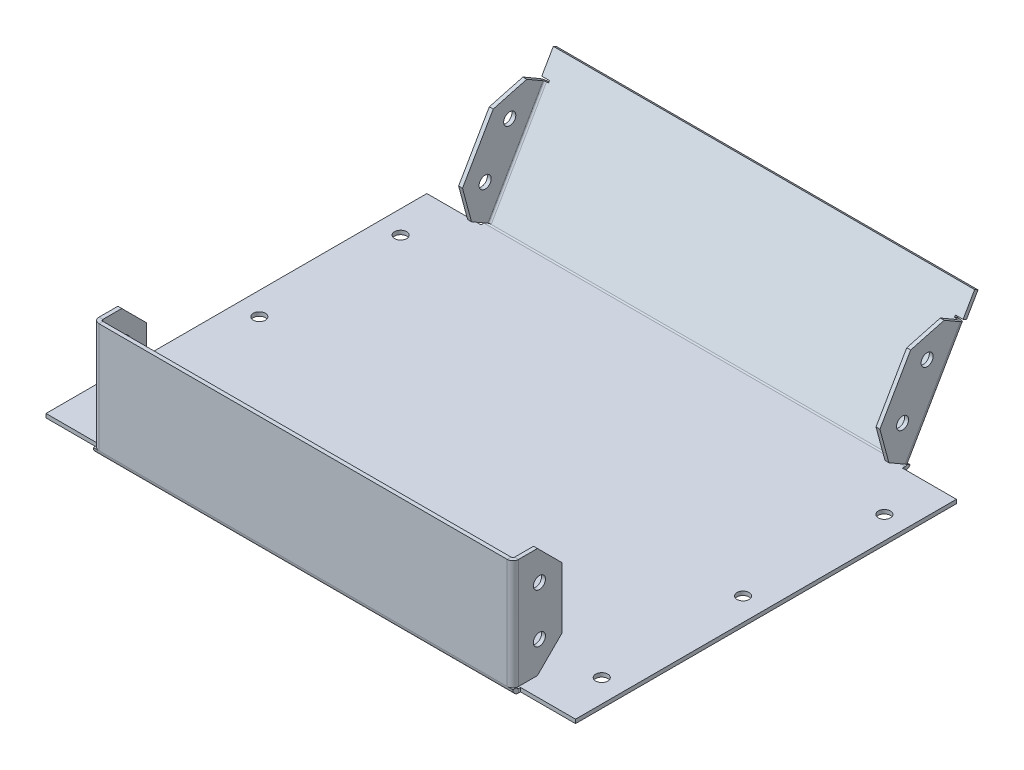
from build123d import *

# Parameters (mm, degrees)
BASE_FLANGE1_DEPTH             = 1.5875
SKETCHED_START                 = -86.375
SKETCHED_BEND1_DEPTH           = 170.75
SKETCHED_START_2               = -82.5
SKETCHED_BEND1_2_DEPTH         = 155
SKETCHED_BEND1_3_DEPTH         = 170.75
SKETCHED_START_3               = -160.625
SKETCHED_BEND1_4_OUTLINE_W     = 1.5875
SKETCHED_BEND1_4_OUTLINE_H     = 155
SKETCHED_BEND1_4_DEPTH         = 44.877834079
SKETCHED_START_4               = 113.747165921
SKETCHED_BEND1_5_OUTLINE_W     = 1.5875
SKETCHED_BEND1_5_OUTLINE_H     = 155
SKETCHED_BEND1_5_DEPTH         = 44.877834079
SKETCHED_BEND1_6_DEPTH         = 155
SKETCHED_START_5               = 75.622165921
SKETCHED_BEND1_7_OUTLINE_W     = 170.75
SKETCHED_BEND1_7_OUTLINE_H     = 1.5875
SKETCHED_BEND1_7_DEPTH         = 44.877834079
SKETCHED_START_6               = -86.725
SKETCHED_BEND2_DEPTH           = 171.45
SKETCHED_BEND2_2_DEPTH         = 171.45
EDGE_FLANGE1_STRIP_W           = 7.8232
EDGE_FLANGE1_STRIP_H           = 1.5875
EDGE_FLANGE1_STRIP_CUT_DEPTH   = 44.798065921
EDGE_FLANGE1_STRIP_2_W         = 7.8232
EDGE_FLANGE1_STRIP_2_H         = 1.5875
EDGE_FLANGE1_STRIP_CUT_2_DEPTH = 44.798065921
EDGE_FLANGE1_DEPTH             = 44.798065921
EDGE_FLANGE1_BEND_DEPTH        = 44.798065921
EDGE_FLANGE2_START             = 43.862084948
EDGE_FLANGE2_DEPTH             = 45.79375
EDGE_FLANGE2_START_2           = 88.862084948
EDGE_FLANGE2_2_DEPTH           = 0.79375
EDGE_FLANGE2_3_DEPTH           = 45
BREAK_CORNER1_START            = -86.725
BREAK_CORNER1_DEPTH            = 171.45
BOSS_EXTRUDE2_START            = -1.5875
BOSS_EXTRUDE2_DEPTH            = 1.5875
BOSS_EXTRUDE3_DEPTH            = 1.5875
CUT_EXTRUDE1_REACH             = 244.631
SKETCH24_R                     = 2.4638
CUT_EXTRUDE2_REACH             = 244.342
SKETCH26_R                     = 2.4638
SKETCH27_W                     = 214.486609943
SKETCH27_H                     = 74.493622792
CUT_EXTRUDE3_DEPTH             = 7
SKETCH28_W                     = 221.663194744
SKETCH28_H                     = 88.143732651
CUT_EXTRUDE4_DEPTH             = 7
SKETCH34_R                     = 2.4638
CUT_EXTRUDE6_DEPTH             = 165.746074293


# Read off the part's stored shape, not the designer's step: Sketched Bend1, Sketched Bend2, Edge-Flange2, Break-Corner1
# Sheet-metal steps are written as plain solids
with BuildPart() as part:
    # Sketch1 → Base-Flange1 (new body)
    with BuildSketch(Plane(origin=(0, 0, 0), x_dir=(1, 0, 0), z_dir=(0, 1, 0))):
        Polygon((-86.375, -72.5), (-86.375, -120.5), (84.375, -120.5), (84.375, -72.5), (110.625, -72.5), (158.625, -72.5), (158.625, 82.5), (110.625, 82.5), (84.725, 82.5), (84.725, 140.5), (-86.725, 140.5), (-86.725, 82.5), (-112.625, 82.5), (-160.625, 82.5), (-160.625, -72.5), (-112.625, -72.5), align=None)
    extrude(amount=BASE_FLANGE1_DEPTH)

    # Sketched Bend1 outline → Sketched Bend1 (add)
    with BuildSketch(Plane.YZ.offset(SKETCHED_START)):
        with BuildLine():
            Line((47.122165921, 74.034665921), (47.122165921, 75.622165921))
            Line((47.122165921, 75.622165921), (2.3241, 75.622165921))
            ThreePointArc((2.3241, 75.622165921), (1.950959343, 75.592015977), (1.5875, 75.5023484))
            Line((1.5875, 75.5023484), (1.5875, 73.298065921))
            ThreePointArc((1.5875, 73.298065921), (1.803245145, 73.818920776), (2.3241, 74.034665921))
            Line((2.3241, 74.034665921), (47.122165921, 74.034665921))
        make_face()
    extrude(amount=SKETCHED_BEND1_DEPTH)

    # Sketched Bend1 2 outline → Sketched Bend1 2 (add)
    with BuildSketch(Plane.XY.offset(SKETCHED_START_2)):
        with BuildLine():
            ThreePointArc((-113.423065921, 1.5875), (-113.943920776, 1.803245145), (-114.159665921, 2.3241))
            Line((-114.159665921, 2.3241), (-114.159665921, 47.122165921))
            Line((-114.159665921, 47.122165921), (-115.747165921, 47.122165921))
            Line((-115.747165921, 47.122165921), (-115.747165921, 2.3241))
            ThreePointArc((-115.747165921, 2.3241), (-115.717015977, 1.950959343), (-115.6273484, 1.5875))
            Line((-115.6273484, 1.5875), (-113.423065921, 1.5875))
        make_face()
        with BuildLine():
            ThreePointArc((112.159665921, 2.3241), (111.943920776, 1.803245145), (111.423065921, 1.5875))
            Line((111.423065921, 1.5875), (113.6273484, 1.5875))
            ThreePointArc((113.6273484, 1.5875), (113.717015977, 1.950959343), (113.747165921, 2.3241))
            Line((113.747165921, 2.3241), (113.747165921, 47.122165921))
            Line((113.747165921, 47.122165921), (112.159665921, 47.122165921))
            Line((112.159665921, 47.122165921), (112.159665921, 2.3241))
        make_face()
    extrude(amount=SKETCHED_BEND1_2_DEPTH)

    # Sketched Bend1 3 outline → Sketched Bend1 3 (cut)
    with BuildSketch(Plane.YZ.offset(SKETCHED_START)):
        with BuildLine():
            ThreePointArc((0, 73.298065921), (0.438182071, 74.656283273), (1.5875, 75.5023484))
            Line((1.5875, 75.5023484), (1.5875, 120.5))
            Line((1.5875, 120.5), (0, 120.5))
            Line((0, 120.5), (0, 73.298065921))
        make_face()
    extrude(amount=SKETCHED_BEND1_3_DEPTH, mode=Mode.SUBTRACT)

    # Sketched Bend1 4 outline → Sketched Bend1 4 (cut)
    with BuildSketch(Plane.YZ.offset(SKETCHED_START_3)):
        with Locations((0.79375, -5)):
            Rectangle(SKETCHED_BEND1_4_OUTLINE_W, SKETCHED_BEND1_4_OUTLINE_H)
    extrude(amount=SKETCHED_BEND1_4_DEPTH, mode=Mode.SUBTRACT)

    # Sketched Bend1 5 outline → Sketched Bend1 5 (cut)
    with BuildSketch(Plane.YZ.offset(SKETCHED_START_4)):
        with Locations((0.79375, -5)):
            Rectangle(SKETCHED_BEND1_5_OUTLINE_W, SKETCHED_BEND1_5_OUTLINE_H)
    extrude(amount=SKETCHED_BEND1_5_DEPTH, mode=Mode.SUBTRACT)

    # Sketched Bend1 6 outline → Sketched Bend1 6 (cut)
    with BuildSketch(Plane.XY.offset(SKETCHED_START_2)):
        with BuildLine():
            ThreePointArc((-113.423065921, 0), (-114.781283273, 0.438182071), (-115.6273484, 1.5875))
            Line((-115.6273484, 1.5875), (-160.625, 1.5875))
            Line((-160.625, 1.5875), (-160.625, 0))
            Line((-160.625, 0), (-113.423065921, 0))
        make_face()
        with BuildLine():
            Line((158.625, 1.5875), (113.6273484, 1.5875))
            ThreePointArc((113.6273484, 1.5875), (112.781283273, 0.438182071), (111.423065921, 0))
            Line((111.423065921, 0), (158.625, 0))
            Line((158.625, 0), (158.625, 1.5875))
        make_face()
    extrude(amount=SKETCHED_BEND1_6_DEPTH, mode=Mode.SUBTRACT)

    # Sketched Bend1 7 outline → Sketched Bend1 7 (cut)
    with BuildSketch(Plane.XY.offset(SKETCHED_START_5)):
        with Locations((-1, 0.79375)):
            Rectangle(SKETCHED_BEND1_7_OUTLINE_W, SKETCHED_BEND1_7_OUTLINE_H)
    extrude(amount=SKETCHED_BEND1_7_DEPTH, mode=Mode.SUBTRACT)

    # Sketched Bend2 outline → Sketched Bend2 (cut)
    with BuildSketch(Plane.YZ.offset(SKETCHED_START_6)):
        with BuildLine():
            Line((1.5875, -140.5), (1.5875, -85.957073927))
            Line((1.5875, -85.957073927), (1.16205, -85.711440255))
            ThreePointArc((1.16205, -85.711440255), (0.311370359, -84.860760614), (0, -83.698710614))
            Line((0, -83.698710614), (0, -140.5))
            Line((0, -140.5), (1.5875, -140.5))
        make_face()
    extrude(amount=SKETCHED_BEND2_DEPTH, mode=Mode.SUBTRACT)

    # Sketched Bend2 2 outline → Sketched Bend2 2 (add)
    with BuildSketch(Plane.YZ.offset(SKETCHED_START_6)):
        with BuildLine():
            Line((49.759285648, -111.935980233), (1.9558, -84.336624926))
            ThreePointArc((1.9558, -84.336624926), (1.686185688, -84.067010614), (1.5875, -83.698710614))
            Line((1.5875, -83.698710614), (1.5875, -85.957073927))
            Line((1.5875, -85.957073927), (48.965535648, -113.310795562))
            Line((48.965535648, -113.310795562), (49.759285648, -111.935980233))
        make_face()
    extrude(amount=SKETCHED_BEND2_2_DEPTH)

    # Edge-Flange1 strip (across the edge) → Edge-Flange1 strip cut (cut)
    with BuildSketch(Plane(origin=(84.375, 47.122165921, 74.034665921), x_dir=(-1, 0, 0), z_dir=(0, -1, 0))):
        with Locations((-1.5875, -0.79375)):
            Rectangle(EDGE_FLANGE1_STRIP_W, EDGE_FLANGE1_STRIP_H)
    extrude(amount=EDGE_FLANGE1_STRIP_CUT_DEPTH, mode=Mode.SUBTRACT)

    # Edge-Flange1 strip 2 (across the edge) → Edge-Flange1 strip cut 2 (cut)
    with BuildSketch(Plane(origin=(-86.375, 2.3241, 74.034665921), x_dir=(1, 0, 0), z_dir=(0, 1, 0))):
        with Locations((-1.5875, -0.79375)):
            Rectangle(EDGE_FLANGE1_STRIP_2_W, EDGE_FLANGE1_STRIP_2_H)
    extrude(amount=EDGE_FLANGE1_STRIP_CUT_2_DEPTH, mode=Mode.SUBTRACT)

    # Edge-Flange1 section (across the edge) → Edge-Flange1 (add)
    with BuildSketch(Plane(origin=(84.375, 47.122165921, 74.034665921), x_dir=(-1, 0, 0), z_dir=(0, -1, 0))):
        with BuildLine():
            Line((0, 0.7366), (0, 18.4125))
            Line((0, 18.4125), (1.5875, 18.4125))
            Line((1.5875, 18.4125), (1.5875, 0.7366))
            ThreePointArc((1.5875, 0.7366), (1.803245145, 0.215745145), (2.3241, 0))
            Line((2.3241, 0), (2.3241, -1.5875))
            ThreePointArc((2.3241, -1.5875), (0.68071313, -0.90678687), (0, 0.7366))
        make_face()
    extrude(amount=EDGE_FLANGE1_DEPTH)

    # Edge-Flange1 section 2 (across the edge) → Edge-Flange1 bend (add)
    with BuildSketch(Plane(origin=(-86.375, 2.3241, 74.034665921), x_dir=(1, 0, 0), z_dir=(0, 1, 0))):
        with BuildLine():
            Line((0, 0.7366), (0, 18.4125))
            Line((0, 18.4125), (1.5875, 18.4125))
            Line((1.5875, 18.4125), (1.5875, 0.7366))
            ThreePointArc((1.5875, 0.7366), (1.803245145, 0.215745145), (2.3241, 0))
            Line((2.3241, 0), (2.3241, -1.5875))
            ThreePointArc((2.3241, -1.5875), (0.68071313, -0.90678687), (0, 0.7366))
        make_face()
    extrude(amount=EDGE_FLANGE1_BEND_DEPTH)

    # Edge-Flange2 outline → Edge-Flange2 (cut)
    with BuildSketch(Plane(origin=(0, 0, 0), x_dir=(1, 0, 0), z_dir=(0, 0.8660254037844406, -0.4999999999999967)).offset(EDGE_FLANGE2_START)):
        with BuildLine():
            Line((-86.725, 72.059759656), (-86.605182479, 72.059759656))
            ThreePointArc((-86.605182479, 72.059759656), (-85.759117352, 73.209077585), (-84.4009, 73.647259656))
            Line((-84.4009, 73.647259656), (-86.725, 73.647259656))
            Line((-86.725, 73.647259656), (-86.725, 72.059759656))
        make_face()
        with BuildLine():
            Line((84.725, 73.647259656), (82.4009, 73.647259656))
            ThreePointArc((82.4009, 73.647259656), (83.759117352, 73.209077585), (84.605182479, 72.059759656))
            Line((84.605182479, 72.059759656), (84.725, 72.059759656))
            Line((84.725, 72.059759656), (84.725, 73.647259656))
        make_face()
    extrude(amount=EDGE_FLANGE2_DEPTH, mode=Mode.SUBTRACT)

    # Edge-Flange2 2 outline → Edge-Flange2 2 (cut)
    with BuildSketch(Plane(origin=(0, 0, 0), x_dir=(1, 0, 0), z_dir=(0, 0.8660254037844406, -0.4999999999999967)).offset(EDGE_FLANGE2_START_2)):
        with BuildLine():
            ThreePointArc((-84.4009, 73.647259656), (-85.759117352, 73.209077585), (-86.605182479, 72.059759656))
            Line((-86.605182479, 72.059759656), (-83.60715, 72.059759656))
            Line((-83.60715, 72.059759656), (-83.60715, 73.647259656))
            Line((-83.60715, 73.647259656), (-84.4009, 73.647259656))
        make_face()
        with BuildLine():
            Line((81.60715, 73.647259656), (81.60715, 72.059759656))
            Line((81.60715, 72.059759656), (84.605182479, 72.059759656))
            ThreePointArc((84.605182479, 72.059759656), (83.759117352, 73.209077585), (82.4009, 73.647259656))
            Line((82.4009, 73.647259656), (81.60715, 73.647259656))
        make_face()
    extrude(amount=EDGE_FLANGE2_2_DEPTH, mode=Mode.SUBTRACT)

    # Edge-Flange2 3 outline → Edge-Flange2 3 (add)
    with BuildSketch(Plane(origin=(0, 0, 0), x_dir=(1, 0, 0), z_dir=(0, 0.8660254037844406, -0.4999999999999967)).offset(EDGE_FLANGE2_START)):
        with BuildLine():
            Line((-86.725, 71.323159656), (-86.725, 53.647259656))
            Line((-86.725, 53.647259656), (-85.1375, 53.647259656))
            Line((-85.1375, 53.647259656), (-85.1375, 71.323159656))
            ThreePointArc((-85.1375, 71.323159656), (-84.921754855, 71.844014511), (-84.4009, 72.059759656))
            Line((-84.4009, 72.059759656), (-86.605182479, 72.059759656))
            ThreePointArc((-86.605182479, 72.059759656), (-86.694850056, 71.696300313), (-86.725, 71.323159656))
        make_face()
        with BuildLine():
            Line((84.605182479, 72.059759656), (82.4009, 72.059759656))
            ThreePointArc((82.4009, 72.059759656), (82.921754855, 71.844014511), (83.1375, 71.323159656))
            Line((83.1375, 71.323159656), (83.1375, 53.647259656))
            Line((83.1375, 53.647259656), (84.725, 53.647259656))
            Line((84.725, 53.647259656), (84.725, 71.323159656))
            ThreePointArc((84.725, 71.323159656), (84.694850056, 71.696300313), (84.605182479, 72.059759656))
        make_face()
    extrude(amount=EDGE_FLANGE2_3_DEPTH)

    # Break-Corner1 outline → Break-Corner1 (cut)
    with BuildSketch(Plane.YZ.offset(BREAK_CORNER1_START)):
        Polygon((50.13319317, -90.890932179), (41.472939132, -85.890932179), (45.13319317, -99.551186217), align=None)
        Polygon((6.16205, -77.051186217), (19.822304038, -73.390932179), (11.16205, -68.390932179), align=None)
        Polygon((47.122165921, 55.622165921), (47.122165921, 65.622165921), (37.122165921, 55.622165921), align=None)
        Polygon((2.3241, 55.622165921), (12.3241, 55.622165921), (2.3241, 65.622165921), align=None)
    extrude(amount=BREAK_CORNER1_DEPTH, mode=Mode.SUBTRACT)

    # Sketch21 → Boss-Extrude2 (add)
    with BuildSketch(Plane.ZY.offset(115.747165921).offset(BOSS_EXTRUDE2_START)):
        Polygon((-82.5, 2.3241), (-82.5, 47.122165921), (-127.298065921, 47.122165921), align=None)
    extrude(amount=BOSS_EXTRUDE2_DEPTH)

    # Sketch22 → Boss-Extrude3 (add)
    with BuildSketch(Plane(origin=(113.747165921, 0, 0), x_dir=(0, 0, -1), z_dir=(1, 0, 0))):
        Polygon((82.5, 2.3241), (82.5, 47.122165921), (127.298065921, 47.122165921), align=None)
    extrude(amount=-BOSS_EXTRUDE3_DEPTH)

    # Sketch24 → Cut-Extrude1 (cut, up to next)
    with BuildSketch(Plane.ZY.offset(86.725), mode=Mode.PRIVATE) as cut_extrude1_sk1:
        with Locations((-92.613778553, 34.704750623)):
            Circle(SKETCH24_R)
    cut_extrude1_tool1 = extrude(cut_extrude1_sk1.sketch, amount=-CUT_EXTRUDE1_REACH, mode=Mode.PRIVATE) & part.part
    # Sketch24 → Cut-Extrude1 (cut, up to next)
    with BuildSketch(Plane.ZY.offset(86.725), mode=Mode.PRIVATE) as cut_extrude1_sk2:
        with Locations(Location((-82.613778553, 17.384242547, 0), (0, 0, 180))):
            Circle(SKETCH24_R)
    cut_extrude1_tool2 = extrude(cut_extrude1_sk2.sketch, amount=-CUT_EXTRUDE1_REACH, mode=Mode.PRIVATE) & part.part
    cut_extrude1_1 = cut_extrude1_tool1.solids().sort_by_distance((-86.725, 34.704751, -92.613779))[0]
    add(cut_extrude1_1, mode=Mode.SUBTRACT)
    cut_extrude1_2 = cut_extrude1_tool2.solids().sort_by_distance((-86.725, 17.384243, -82.613779))[0]
    add(cut_extrude1_2, mode=Mode.SUBTRACT)
    cut_extrude1 = cut_extrude1_1 + cut_extrude1_2  # Cut-Extrude1 as one shape, for the pattern or mirror that repeats it

    # Sketch26 → Cut-Extrude2 (cut, up to next)
    with BuildSketch(Plane.ZY.offset(86.375), mode=Mode.PRIVATE) as cut_extrude2_sk1:
        with Locations((64.828415921, 34.72313296)):
            Circle(SKETCH26_R)
    cut_extrude2_tool1 = extrude(cut_extrude2_sk1.sketch, amount=-CUT_EXTRUDE2_REACH, mode=Mode.PRIVATE) & part.part
    # Sketch26 → Cut-Extrude2 (cut, up to next)
    with BuildSketch(Plane.ZY.offset(86.375), mode=Mode.PRIVATE) as cut_extrude2_sk2:
        with Locations(Location((64.828415921, 14.72313296, 0), (0, 0, 180))):
            Circle(SKETCH26_R)
    cut_extrude2_tool2 = extrude(cut_extrude2_sk2.sketch, amount=-CUT_EXTRUDE2_REACH, mode=Mode.PRIVATE) & part.part
    cut_extrude2_1 = cut_extrude2_tool1.solids().sort_by_distance((-86.375, 34.723133, 64.828416))[0]
    add(cut_extrude2_1, mode=Mode.SUBTRACT)
    cut_extrude2_2 = cut_extrude2_tool2.solids().sort_by_distance((-86.375, 14.723133, 64.828416))[0]
    add(cut_extrude2_2, mode=Mode.SUBTRACT)
    cut_extrude2 = cut_extrude2_1 + cut_extrude2_2  # Cut-Extrude2 as one shape, for the pattern or mirror that repeats it

    # Mirror1: Cut-Extrude1, Cut-Extrude2 mirrored; each copy of Cut-Extrude1, Cut-Extrude2 runs up to whatever stops it at its own place
    mirror1_before = part.part  # the part as the pattern finds it: every copy runs up to it
    mirror1_cut_extrude1_long1 = extrude(cut_extrude1_sk1.sketch, amount=-CUT_EXTRUDE1_REACH, mode=Mode.PRIVATE)
    mirror1_cut_extrude1_long2 = extrude(cut_extrude1_sk2.sketch, amount=-CUT_EXTRUDE1_REACH, mode=Mode.PRIVATE)
    mirror1_cut_extrude1_tool1_1 = mirror1_cut_extrude1_long1.mirror(Plane(origin=(0, 0, 0), x_dir=(0, 0, 1), z_dir=(1, 0, 0))) & mirror1_before
    add(mirror1_cut_extrude1_tool1_1.solids().sort_by_distance((86.725, 34.704751, -92.613779))[0], mode=Mode.SUBTRACT)
    mirror1_cut_extrude1_tool2_1 = mirror1_cut_extrude1_long2.mirror(Plane(origin=(0, 0, 0), x_dir=(0, 0, 1), z_dir=(1, 0, 0))) & mirror1_before
    add(mirror1_cut_extrude1_tool2_1.solids().sort_by_distance((86.725, 17.384243, -82.613779))[0], mode=Mode.SUBTRACT)
    mirror1_cut_extrude2_long1 = extrude(cut_extrude2_sk1.sketch, amount=-CUT_EXTRUDE2_REACH, mode=Mode.PRIVATE)
    mirror1_cut_extrude2_long2 = extrude(cut_extrude2_sk2.sketch, amount=-CUT_EXTRUDE2_REACH, mode=Mode.PRIVATE)
    mirror1_cut_extrude2_tool1_1 = mirror1_cut_extrude2_long1.mirror(Plane(origin=(0, 0, 0), x_dir=(0, 0, 1), z_dir=(1, 0, 0))) & mirror1_before
    add(mirror1_cut_extrude2_tool1_1.solids().sort_by_distance((86.375, 34.723133, 64.828416))[0], mode=Mode.SUBTRACT)
    mirror1_cut_extrude2_tool2_1 = mirror1_cut_extrude2_long2.mirror(Plane(origin=(0, 0, 0), x_dir=(0, 0, 1), z_dir=(1, 0, 0))) & mirror1_before
    add(mirror1_cut_extrude2_tool2_1.solids().sort_by_distance((86.375, 14.723133, 64.828416))[0], mode=Mode.SUBTRACT)

    # Sketch27 → Cut-Extrude3 (cut)
    with BuildSketch(Plane.ZY.offset(115.747165921)):
        with Locations((-25.482320462, 18.910964918)):
            Rectangle(SKETCH27_W, SKETCH27_H)
    extrude(amount=-CUT_EXTRUDE3_DEPTH, mode=Mode.SUBTRACT)

    # Sketch28 → Cut-Extrude4 (cut)
    with BuildSketch(Plane(origin=(113.747165921, 0, 0), x_dir=(0, 0, -1), z_dir=(1, 0, 0))):
        with Locations((27.271761176, 22.455760889)):
            Rectangle(SKETCH28_W, SKETCH28_H)
    extrude(amount=-CUT_EXTRUDE4_DEPTH, mode=Mode.SUBTRACT)

    # Sketch34 → Cut-Extrude6 (cut, through all)
    with BuildSketch(Plane(origin=(0, 0, 0), x_dir=(-1, 0, 0), z_dir=(0, -1, 0))):
        with Locations(Location((-97.425, -52.5, 0), (0, 0, 90))):
            Circle(SKETCH34_R)
        with Locations(Location((-97.425, 62.5, 0), (0, 0, 90))):
            Circle(SKETCH34_R)
        with Locations(Location((-97.425, 5, 0), (0, 0, 90))):
            Circle(SKETCH34_R)
        with Locations(Location((99.425, -52.5, 0), (0, 0, 90))):
            Circle(SKETCH34_R)
        with Locations(Location((99.425, 5, 0), (0, 0, 90))):
            Circle(SKETCH34_R)
        with Locations(Location((99.425, 62.5, 0), (0, 0, 90))):
            Circle(SKETCH34_R)
    extrude(amount=-CUT_EXTRUDE6_DEPTH, mode=Mode.SUBTRACT)


solid = part.part
